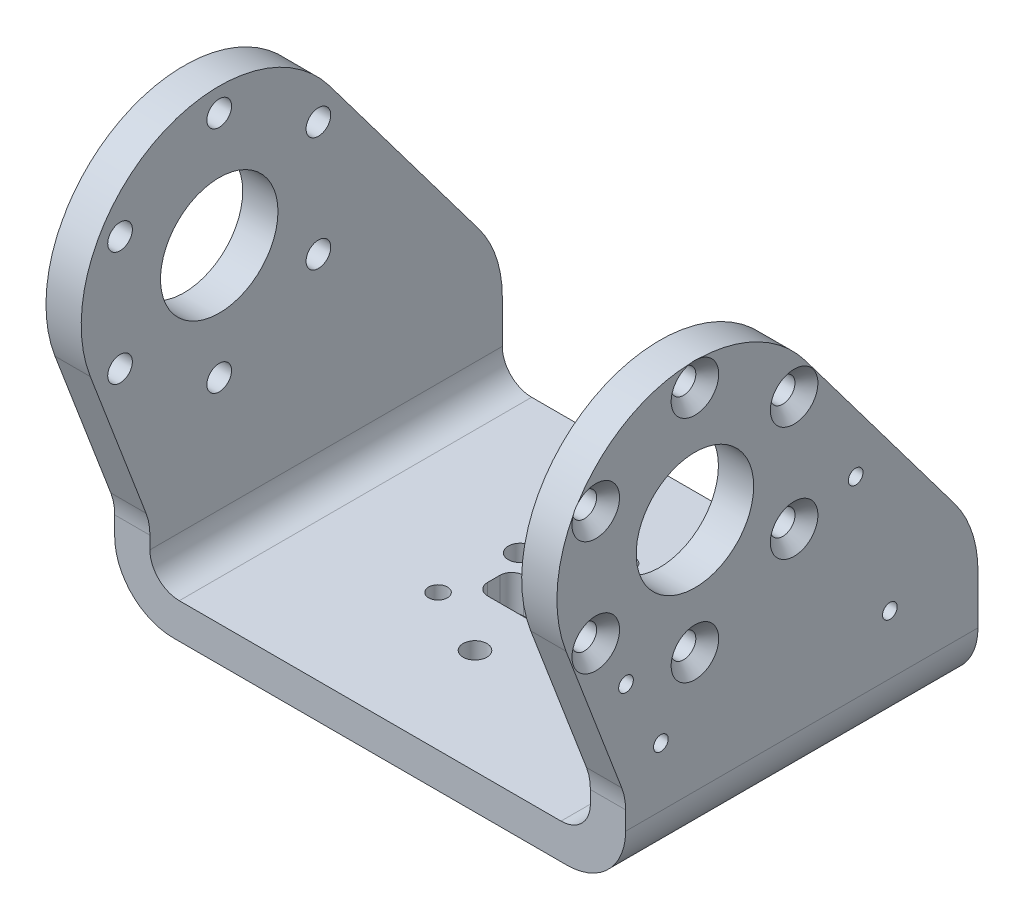
from build123d import *

# Parameters (mm, degrees)
SKETCH_1_W                   = 87
SKETCH_1_H                   = 60
SKETCH_1_R                   = 1.6
SKETCH_1_R_2                 = 2.025
EXTRUDE_1_DEPTH              = 6
SKETCH_2_R                   = 10
SKETCH_2_R_2                 = 2.05
EXTRUDE_2_DEPTH              = 6
FILLET_1_R                   = 20
FILLET_3_R                   = 5
FILLET_4_R                   = 10
FILLET_5_R                   = 10
HOLE_START                   = 81
HOLE_WIZARD_M3_1_OUTLINE_R   = 1.25
HOLE_WIZARD_M3_1_DEPTH       = 6
HOLE_WIZARD_M4_1_D           = 4.2
HOLE_WIZARD_M4_1_CSINK_D     = 8.1
HOLE_WIZARD_M4_1_CSINK_ANGLE = 90
HOLE_WIZARD_M4_2_D           = 4.2
HOLE_WIZARD_M4_2_CSINK_D     = 8.1
HOLE_WIZARD_M4_2_CSINK_ANGLE = 90


# Read off the part's stored shape, not the designer's step: M3 螺纹孔1
with BuildPart() as part:
    # 草图1 → 凸台-拉伸1 (new body)
    with BuildSketch(Plane(origin=(0, 0, 0), x_dir=(1, 0, 0), z_dir=(0, 1, 0))):
        with Locations((43.5, 30)):
            Rectangle(SKETCH_1_W, SKETCH_1_H)
        with Locations(Location((43.5, 43.5, 0), (0, 0, 270))):
            Circle(SKETCH_1_R, mode=Mode.SUBTRACT)
        with Locations(Location((55.191342951, 23.25, 0), (0, 0, 270))):
            Circle(SKETCH_1_R, mode=Mode.SUBTRACT)
        with Locations(Location((31.808657049, 23.25, 0), (0, 0, 270))):
            Circle(SKETCH_1_R, mode=Mode.SUBTRACT)
        with Locations(Location((54.022208656, 36.075, 0), (0, 0, 270))):
            Circle(SKETCH_1_R_2, mode=Mode.SUBTRACT)
        with Locations(Location((43.5, 17.85, 0), (0, 0, 270))):
            Circle(SKETCH_1_R_2, mode=Mode.SUBTRACT)
        with Locations(Location((32.977791344, 36.075, 0), (0, 0, 270))):
            Circle(SKETCH_1_R_2, mode=Mode.SUBTRACT)
        with BuildLine():
            Line((36.55, 33.05), (50.45, 33.05))
            ThreePointArc((50.45, 33.05), (51.864213562, 32.464213562), (52.45, 31.05))
            Line((52.45, 31.05), (52.45, 28.95))
            ThreePointArc((52.45, 28.95), (51.864213562, 27.535786438), (50.45, 26.95))
            Line((50.45, 26.95), (36.55, 26.95))
            ThreePointArc((36.55, 26.95), (35.135786438, 27.535786438), (34.55, 28.95))
            Line((34.55, 28.95), (34.55, 31.05))
            ThreePointArc((34.55, 31.05), (35.135786438, 32.464213562), (36.55, 33.05))
        make_face(mode=Mode.SUBTRACT)
    extrude(amount=EXTRUDE_1_DEPTH)

    # 草图2 → 凸台-拉伸2 (add)
    with BuildSketch(Plane(origin=(87, 0, 0), x_dir=(0, 0, -1), z_dir=(1, 0, 0))):
        with BuildLine():
            Line((60, 0), (60, 25))
            Line((60, 25), (30.584528933, 64.122584185))
            ThreePointArc((30.584528933, 64.122584185), (0.441305267, 70.571734049), (-10.155502807, 41.625004949))
            Line((-10.155502807, 41.625004949), (0, 15))
            Line((0, 15), (0, 0))
            Line((0, 0), (60, 0))
        make_face()
        with Locations((11.801488287, 50)):
            Circle(SKETCH_2_R, mode=Mode.SUBTRACT)
        with Locations((11.801488287, 69.5)):
            Circle(SKETCH_2_R_2, mode=Mode.SUBTRACT)
        with Locations((28.68898366, 59.75)):
            Circle(SKETCH_2_R_2, mode=Mode.SUBTRACT)
        with Locations((28.68898366, 40.25)):
            Circle(SKETCH_2_R_2, mode=Mode.SUBTRACT)
        with Locations((11.801488287, 30.5)):
            Circle(SKETCH_2_R_2, mode=Mode.SUBTRACT)
        with Locations((-5.086007087, 40.25)):
            Circle(SKETCH_2_R_2, mode=Mode.SUBTRACT)
        with Locations((-5.086007087, 59.75)):
            Circle(SKETCH_2_R_2, mode=Mode.SUBTRACT)
    extrude_2 = extrude(amount=-EXTRUDE_2_DEPTH)

    # 镜向1: 凸台-拉伸2 across plane
    add(extrude_2.mirror(Plane(origin=(43.5, 0, 0), x_dir=(0, 0, 1), z_dir=(1, 0, 0))))

    # 圆角1
    fillet_1_edges = [part.edges().sort_by_distance(p)[0] for p in [
        (3, 25, -60),
        (84, 25, -60),
    ]]
    fillet(fillet_1_edges, radius=FILLET_1_R)

    # 圆角3
    fillet_3_edges = [part.edges().sort_by_distance(p)[0] for p in [
        (6, 6, -30),
        (81, 6, -30),
    ]]
    fillet(fillet_3_edges, radius=FILLET_3_R)

    # 圆角4
    fillet_4_edges = [part.edges().sort_by_distance(p)[0] for p in [
        (87, 0, -30),
        (0, 0, -30),
    ]]
    fillet(fillet_4_edges, radius=FILLET_4_R)

    # 圆角5
    fillet_5_edges = [part.edges().sort_by_distance(p)[0] for p in [
        (3, 15, 0),
        (84, 15, 0),
    ]]
    fillet(fillet_5_edges, radius=FILLET_5_R)

    # Hole Wizard M3 _1 outline → Hole Wizard M3 _1 (cut)
    with BuildSketch(Plane.YZ.offset(HOLE_START)):
        with Locations((20, -6)):
            Circle(HOLE_WIZARD_M3_1_OUTLINE_R)
        with Locations((42.717410522, -39.171869507)):
            Circle(HOLE_WIZARD_M3_1_OUTLINE_R)
        with Locations((20, -45)):
            Circle(HOLE_WIZARD_M3_1_OUTLINE_R)
        with Locations((31.676227091, -0.060877223)):
            Circle(HOLE_WIZARD_M3_1_OUTLINE_R)
    extrude(amount=HOLE_WIZARD_M3_1_DEPTH, mode=Mode.SUBTRACT)

    # M4 十字槽半沉头木螺钉的锥形沉头孔1 (through all)
    with Locations(Plane.ZY):
        with Locations((-11.801488287, 69.5), (-28.68898366, 59.75), (-28.68898366, 40.25), (-11.801488287, 30.5), (5.086007087, 40.25), (5.086007087, 59.75)):
            CounterSinkHole(HOLE_WIZARD_M4_1_D / 2, HOLE_WIZARD_M4_1_CSINK_D / 2, counter_sink_angle=HOLE_WIZARD_M4_1_CSINK_ANGLE)

    # M4 十字槽半沉头木螺钉的锥形沉头孔2 (through all)
    with Locations(Plane(origin=(87, 0, 0), x_dir=(0, 0, -1), z_dir=(1, 0, 0))):
        with Locations((11.801488287, 69.5), (-5.086007087, 59.75), (-5.086007087, 40.25), (11.801488287, 30.5), (28.68898366, 40.25), (28.68898366, 59.75)):
            CounterSinkHole(HOLE_WIZARD_M4_2_D / 2, HOLE_WIZARD_M4_2_CSINK_D / 2, counter_sink_angle=HOLE_WIZARD_M4_2_CSINK_ANGLE)


solid = part.part
